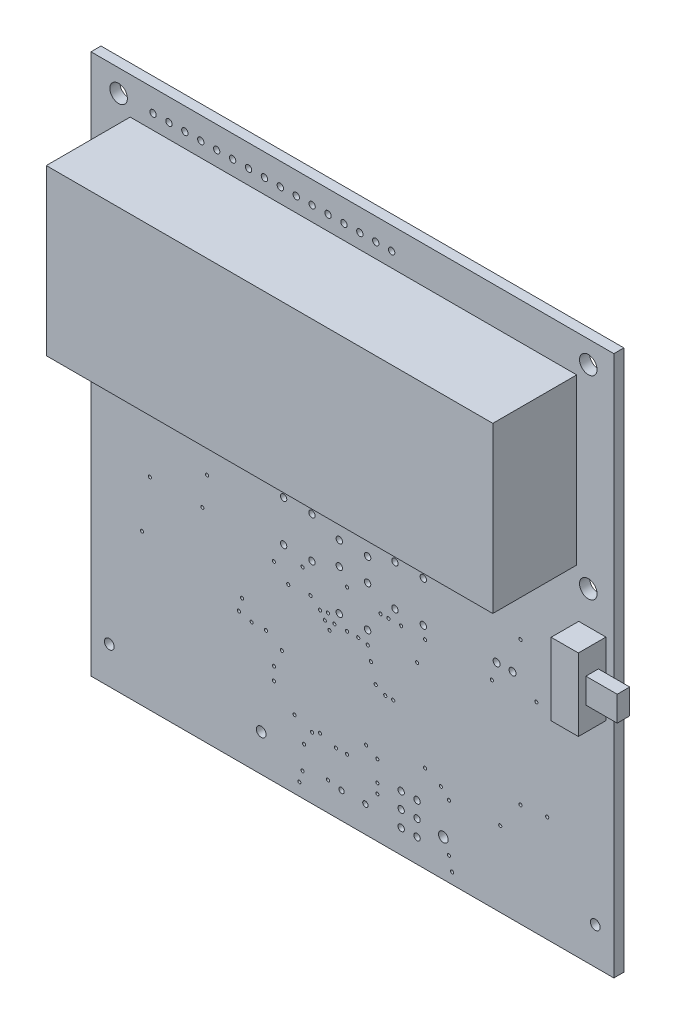
from build123d import *

# Parameters (mm, degrees)
SKETCH_20_W         = 83.49
SKETCH_20_H         = 86.34
SKETCH_20_R         = 0.425
SKETCH_20_R_2       = 0.775
SKETCH_20_R_3       = 1.4
BOSS_EXTRUDE1_DEPTH = 1.6
SKETCH_44_R         = 0.508
SKETCH_44_R_2       = 0.5588
SKETCH_44_R_3       = 0.25
CUT_EXTRUDE3_DEPTH  = 1.6
SKETCH18_W          = 71.3
SKETCH18_H          = 26.3
BOSS_EXTRUDE3_DEPTH = 15
SKETCH19_W          = 4.346879385
SKETCH19_H          = 11.556648182
BOSS_EXTRUDE4_DEPTH = 4.4
SKETCH20_W          = 2
SKETCH20_H          = 4
BOSS_EXTRUDE5_DEPTH = 5


with BuildPart() as part:
    # Sketch 20 → Boss-Extrude1 (new body)
    with BuildSketch(Plane.XY):
        with Locations((41.745, 43.19)):
            Rectangle(SKETCH_20_W, SKETCH_20_H)
        with Locations((40.01, 4.232)):
            Circle(SKETCH_20_R, mode=Mode.SUBTRACT)
        with Locations((43.81, 4.232)):
            Circle(SKETCH_20_R, mode=Mode.SUBTRACT)
        with Locations((27.18, 5.91)):
            Circle(SKETCH_20_R_2, mode=Mode.SUBTRACT)
        with Locations((2.92, 5.91)):
            Circle(SKETCH_20_R_2, mode=Mode.SUBTRACT)
        with Locations((80.52, 5.91)):
            Circle(SKETCH_20_R_2, mode=Mode.SUBTRACT)
        with Locations((56.26, 5.91)):
            Circle(SKETCH_20_R_2, mode=Mode.SUBTRACT)
        with Locations((4.41, 82.81)):
            Circle(SKETCH_20_R_3, mode=Mode.SUBTRACT)
        with Locations((4.41, 51.81)):
            Circle(SKETCH_20_R_3, mode=Mode.SUBTRACT)
        with Locations((79.41, 82.81)):
            Circle(SKETCH_20_R_3, mode=Mode.SUBTRACT)
        with Locations((79.41, 51.81)):
            Circle(SKETCH_20_R_3, mode=Mode.SUBTRACT)
    extrude(amount=BOSS_EXTRUDE1_DEPTH)

    # Sketch 44 → Cut-Extrude3 (cut)
    with BuildSketch(Plane.XY):
        with Locations((52.07, 3.81)):
            Circle(SKETCH_44_R)
        with Locations((49.53, 3.81)):
            Circle(SKETCH_44_R)
        with Locations((52.07, 6.35)):
            Circle(SKETCH_44_R)
        with Locations((49.53, 6.35)):
            Circle(SKETCH_44_R)
        with Locations((52.07, 8.89)):
            Circle(SKETCH_44_R)
        with Locations((49.53, 8.89)):
            Circle(SKETCH_44_R)
        with Locations((67.31, 34.29)):
            Circle(SKETCH_44_R_2)
        with Locations((64.77, 34.29)):
            Circle(SKETCH_44_R_2)
        with Locations((33.02, 58.42)):
            Circle(SKETCH_44_R)
        with Locations((35.56, 58.42)):
            Circle(SKETCH_44_R)
        with Locations((38.1, 58.42)):
            Circle(SKETCH_44_R)
        with Locations((40.64, 58.42)):
            Circle(SKETCH_44_R)
        with Locations((43.18, 58.42)):
            Circle(SKETCH_44_R)
        with Locations((45.72, 58.42)):
            Circle(SKETCH_44_R)
        with Locations((48.26, 58.42)):
            Circle(SKETCH_44_R)
        with Locations((50.8, 58.42)):
            Circle(SKETCH_44_R)
        with Locations((44.1706, 35.0012)):
            Circle(SKETCH_44_R)
        with Locations((44.1706, 28.4988)):
            Circle(SKETCH_44_R)
        with Locations((39.6494, 35.0012)):
            Circle(SKETCH_44_R)
        with Locations((39.6494, 28.4988)):
            Circle(SKETCH_44_R)
        with Locations((44.1706, 45.1612)):
            Circle(SKETCH_44_R)
        with Locations((44.1706, 38.6588)):
            Circle(SKETCH_44_R)
        with Locations((39.6494, 45.1612)):
            Circle(SKETCH_44_R)
        with Locations((39.6494, 38.6588)):
            Circle(SKETCH_44_R)
        with Locations((53.0606, 40.0812)):
            Circle(SKETCH_44_R)
        with Locations((53.0606, 33.5788)):
            Circle(SKETCH_44_R)
        with Locations((48.5394, 40.0812)):
            Circle(SKETCH_44_R)
        with Locations((48.5394, 33.5788)):
            Circle(SKETCH_44_R)
        with Locations((35.2806, 40.0812)):
            Circle(SKETCH_44_R)
        with Locations((35.2806, 33.5788)):
            Circle(SKETCH_44_R)
        with Locations((30.7594, 40.0812)):
            Circle(SKETCH_44_R)
        with Locations((30.7594, 33.5788)):
            Circle(SKETCH_44_R)
        with Locations((80.01, 43.18)):
            Circle(SKETCH_44_R)
        with Locations((80.01, 40.64)):
            Circle(SKETCH_44_R)
        with Locations((80.01, 38.1)):
            Circle(SKETCH_44_R)
        with Locations((9.91, 82.81)):
            Circle(SKETCH_44_R)
        with Locations((12.45, 82.81)):
            Circle(SKETCH_44_R)
        with Locations((14.99, 82.81)):
            Circle(SKETCH_44_R)
        with Locations((17.53, 82.81)):
            Circle(SKETCH_44_R)
        with Locations((20.07, 82.81)):
            Circle(SKETCH_44_R)
        with Locations((22.61, 82.81)):
            Circle(SKETCH_44_R)
        with Locations((25.15, 82.81)):
            Circle(SKETCH_44_R)
        with Locations((27.69, 82.81)):
            Circle(SKETCH_44_R)
        with Locations((30.23, 82.81)):
            Circle(SKETCH_44_R)
        with Locations((32.77, 82.81)):
            Circle(SKETCH_44_R)
        with Locations((35.31, 82.81)):
            Circle(SKETCH_44_R)
        with Locations((37.85, 82.81)):
            Circle(SKETCH_44_R)
        with Locations((40.39, 82.81)):
            Circle(SKETCH_44_R)
        with Locations((42.93, 82.81)):
            Circle(SKETCH_44_R)
        with Locations((45.47, 82.81)):
            Circle(SKETCH_44_R)
        with Locations((48.01, 82.81)):
            Circle(SKETCH_44_R)
        with Locations((25.654, 20.32)):
            Circle(SKETCH_44_R_3)
        with Locations((45.72, 11.43)):
            Circle(SKETCH_44_R_3)
        with Locations((31.496, 28.448)):
            Circle(SKETCH_44_R_3)
        with Locations((44.704, 24.384)):
            Circle(SKETCH_44_R_3)
        with Locations((30.48, 18.796)):
            Circle(SKETCH_44_R_3)
        with Locations((68.58, 16.51)):
            Circle(SKETCH_44_R_3)
        with Locations((29.21, 16.002)):
            Circle(SKETCH_44_R_3)
        with Locations((67.31, 59.69)):
            Circle(SKETCH_44_R_3)
        with Locations((69.85, 64.77)):
            Circle(SKETCH_44_R_3)
        with Locations((48.26, 60.96)):
            Circle(SKETCH_44_R_3)
        with Locations((52.07, 64.77)):
            Circle(SKETCH_44_R_3)
        with Locations((34.29, 64.77)):
            Circle(SKETCH_44_R_3)
        with Locations((39.878, 49.784)):
            Circle(SKETCH_44_R_3)
        with Locations((37.465, 61.595)):
            Circle(SKETCH_44_R_3)
        with Locations((41.402, 49.784)):
            Circle(SKETCH_44_R_3)
        with Locations((21.59, 59.69)):
            Circle(SKETCH_44_R_3)
        with Locations((16.51, 64.77)):
            Circle(SKETCH_44_R_3)
        with Locations((42.672, 49.784)):
            Circle(SKETCH_44_R_3)
        with Locations((43.942, 49.784)):
            Circle(SKETCH_44_R_3)
        with Locations((36.576, 10.414)):
            Circle(SKETCH_44_R_3)
        with Locations((40.894, 9.652)):
            Circle(SKETCH_44_R_3)
        with Locations((35.306, 9.906)):
            Circle(SKETCH_44_R_3)
        with Locations((39.116, 9.652)):
            Circle(SKETCH_44_R_3)
        with Locations((62.23, 46.99)):
            Circle(SKETCH_44_R_3)
        with Locations((48.26, 20.828)):
            Circle(SKETCH_44_R_3)
        with Locations((24.13, 22.86)):
            Circle(SKETCH_44_R_3)
        with Locations((40.894, 26.67)):
            Circle(SKETCH_44_R_3)
        with Locations((40.894, 32.766)):
            Circle(SKETCH_44_R_3)
        with Locations((37.846, 27.686)):
            Circle(SKETCH_44_R_3)
        with Locations((47.498, 31.75)):
            Circle(SKETCH_44_R_3)
        with Locations((49.53, 31.75)):
            Circle(SKETCH_44_R_3)
        with Locations((53.34, 31.75)):
            Circle(SKETCH_44_R_3)
        with Locations((64.008, 31.496)):
            Circle(SKETCH_44_R_3)
        with Locations((8.128, 24.13)):
            Circle(SKETCH_44_R_3)
        with Locations((38.862, 26.67)):
            Circle(SKETCH_44_R_3)
        with Locations((55.88, 12.7)):
            Circle(SKETCH_44_R_3)
        with Locations((32.512, 10.922)):
            Circle(SKETCH_44_R_3)
        with Locations((67.945, 78.105)):
            Circle(SKETCH_44_R_3)
        with Locations((59.055, 78.105)):
            Circle(SKETCH_44_R_3)
        with Locations((50.165, 78.105)):
            Circle(SKETCH_44_R_3)
        with Locations((41.275, 78.105)):
            Circle(SKETCH_44_R_3)
        with Locations((35.687, 74.295)):
            Circle(SKETCH_44_R_3)
        with Locations((23.495, 78.105)):
            Circle(SKETCH_44_R_3)
        with Locations((5.715, 78.105)):
            Circle(SKETCH_44_R_3)
        with Locations((14.605, 78.105)):
            Circle(SKETCH_44_R_3)
        with Locations((13.208, 65.532)):
            Circle(SKETCH_44_R_3)
        with Locations((48.768, 65.532)):
            Circle(SKETCH_44_R_3)
        with Locations((66.548, 65.532)):
            Circle(SKETCH_44_R_3)
        with Locations((57.658, 65.532)):
            Circle(SKETCH_44_R_3)
        with Locations((75.438, 65.532)):
            Circle(SKETCH_44_R_3)
        with Locations((39.878, 65.532)):
            Circle(SKETCH_44_R_3)
        with Locations((22.098, 65.532)):
            Circle(SKETCH_44_R_3)
        with Locations((69.088, 61.722)):
            Circle(SKETCH_44_R_3)
        with Locations((51.308, 61.976)):
            Circle(SKETCH_44_R_3)
        with Locations((34.29, 62.23)):
            Circle(SKETCH_44_R_3)
        with Locations((15.748, 61.722)):
            Circle(SKETCH_44_R_3)
        with Locations((61.976, 42.926)):
            Circle(SKETCH_44_R_3)
        with Locations((68.58, 39.37)):
            Circle(SKETCH_44_R_3)
        with Locations((71.12, 32.004)):
            Circle(SKETCH_44_R_3)
        with Locations((38.862, 56.134)):
            Circle(SKETCH_44_R_3)
        with Locations((48.006, 52.324)):
            Circle(SKETCH_44_R_3)
        with Locations((48.006, 47.244)):
            Circle(SKETCH_44_R_3)
        with Locations((66.04, 49.53)):
            Circle(SKETCH_44_R_3)
        with Locations((52.07, 27.94)):
            Circle(SKETCH_44_R_3)
        with Locations((53.34, 13.97)):
            Circle(SKETCH_44_R_3)
        with Locations((45.72, 6.604)):
            Circle(SKETCH_44_R_3)
        with Locations((34.036, 7.62)):
            Circle(SKETCH_44_R_3)
        with Locations((9.398, 32.258)):
            Circle(SKETCH_44_R_3)
        with Locations((17.78, 32.258)):
            Circle(SKETCH_44_R_3)
        with Locations((18.542, 37.084)):
            Circle(SKETCH_44_R_3)
        with Locations((33.782, 32.004)):
            Circle(SKETCH_44_R_3)
        with Locations((35.56, 69.85)):
            Circle(SKETCH_44_R_3)
        with Locations((49.53, 45.72)):
            Circle(SKETCH_44_R_3)
        with Locations((29.21, 13.97)):
            Circle(SKETCH_44_R_3)
        with Locations((42.672, 26.67)):
            Circle(SKETCH_44_R_3)
        with Locations((8.89, 44.45)):
            Circle(SKETCH_44_R_3)
        with Locations((36.576, 27.432)):
            Circle(SKETCH_44_R_3)
        with Locations((29.21, 30.48)):
            Circle(SKETCH_44_R_3)
        with Locations((27.94, 20.32)):
            Circle(SKETCH_44_R_3)
        with Locations((43.942, 12.446)):
            Circle(SKETCH_44_R_3)
        with Locations((31.75, 41.91)):
            Circle(SKETCH_44_R_3)
        with Locations((35.052, 28.702)):
            Circle(SKETCH_44_R_3)
        with Locations((37.338, 26.416)):
            Circle(SKETCH_44_R_3)
        with Locations((38.1, 25.4)):
            Circle(SKETCH_44_R_3)
        with Locations((33.274, 2.032)):
            Circle(SKETCH_44_R_3)
        with Locations((23.622, 20.828)):
            Circle(SKETCH_44_R_3)
        with Locations((72.85, 16.97)):
            Circle(SKETCH_44_R_3)
        with Locations((57.658, 1.778)):
            Circle(SKETCH_44_R_3)
        with Locations((74.93, 36.83)):
            Circle(SKETCH_44_R_3)
        with Locations((64.77, 58.42)):
            Circle(SKETCH_44_R_3)
        with Locations((8.89, 67.31)):
            Circle(SKETCH_44_R_3)
        with Locations((45.72, 8.128)):
            Circle(SKETCH_44_R_3)
        with Locations((33.782, 3.81)):
            Circle(SKETCH_44_R_3)
        with Locations((57.15, 3.81)):
            Circle(SKETCH_44_R_3)
        with Locations((65.35, 12.01)):
            Circle(SKETCH_44_R_3)
        with Locations((39.37, 41.91)):
            Circle(SKETCH_44_R_3)
        with Locations((44.196, 26.416)):
            Circle(SKETCH_44_R_3)
        with Locations((49.53, 53.34)):
            Circle(SKETCH_44_R_3)
        with Locations((45.466, 21.59)):
            Circle(SKETCH_44_R_3)
        with Locations((46.99, 20.828)):
            Circle(SKETCH_44_R_3)
        with Locations((46.228, 31.75)):
            Circle(SKETCH_44_R_3)
        with Locations((57.15, 11.43)):
            Circle(SKETCH_44_R_3)
        with Locations((37.846, 4.572)):
            Circle(SKETCH_44_R_3)
    extrude(amount=CUT_EXTRUDE3_DEPTH, mode=Mode.SUBTRACT)

    # Sketch18 → Boss-Extrude3 (add)
    with BuildSketch(Plane.XY):
        with Locations((41.91, 67.31)):
            Rectangle(SKETCH18_W, SKETCH18_H)
    extrude(amount=BOSS_EXTRUDE3_DEPTH)

    # Sketch19 → Boss-Extrude4 (add)
    with BuildSketch(Plane.XY.offset(1.6)):
        with Locations((80.051684532, 40.757308925)):
            Rectangle(SKETCH19_W, SKETCH19_H)
    extrude(amount=BOSS_EXTRUDE4_DEPTH)

    # Sketch20 → Boss-Extrude5 (add)
    with BuildSketch(Plane(origin=(82.225124224, 0, 0), x_dir=(0, 0, -1), z_dir=(1, 0, 0))):
        with Locations((-3.8, 40.728984834)):
            Rectangle(SKETCH20_W, SKETCH20_H)
    extrude(amount=BOSS_EXTRUDE5_DEPTH)


solid = part.part
